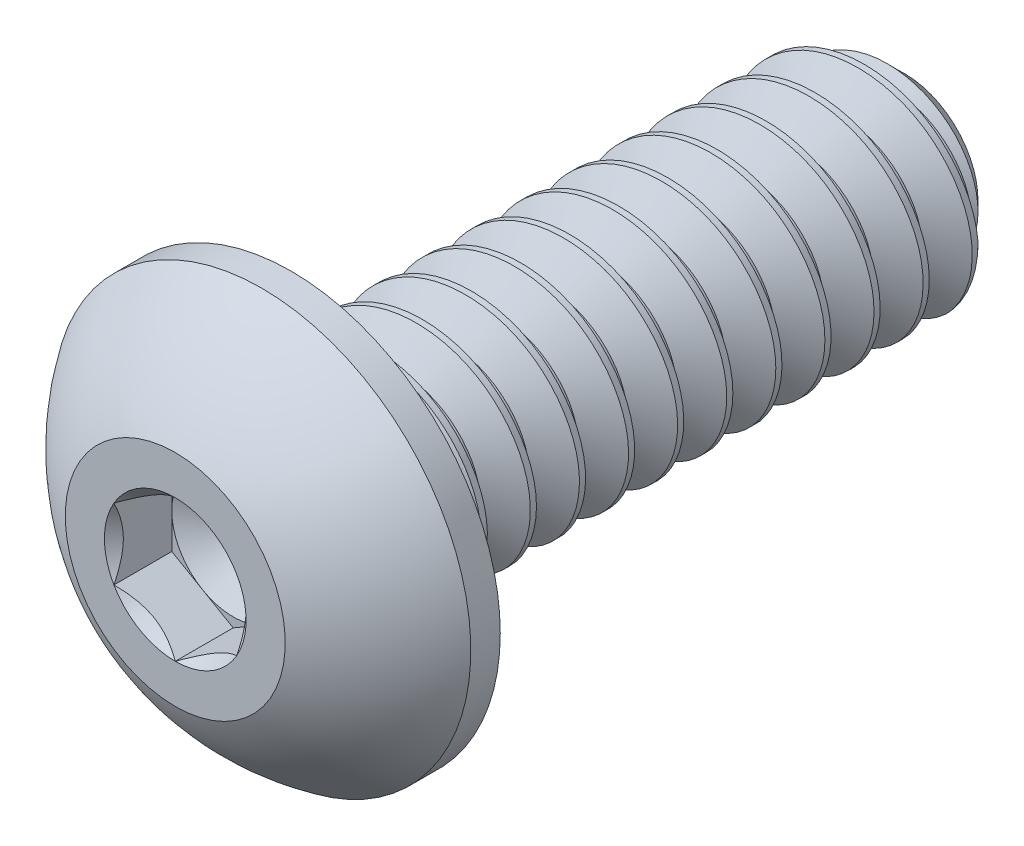
from build123d import *

# Parameters (mm, degrees)
SKETCH1_W          = 7.9375
SKETCH1_H          = 1.4224
CHAMFER1_SIZE      = 0.47625
CUT_SWEEP1_PITCH   = 0.635
SKETCH4_R          = 2.7051
EXTRUDE1_DEPTH     = 1.4986
CUT_EXTRUDE1_DEPTH = 0.7493
SKETCH7_R          = 0.916543552
CUT_EXTRUDE4_DEPTH = 0.7493
CUT_EXTRUDE4_DRAFT = -45
SKETCH8_R          = 0.79375
CUT_EXTRUDE5_DEPTH = 0.249766667
CUT_EXTRUDE5_DRAFT = -60


with BuildPart() as part:
    # Sketch1 → Revolve1 (revolve)
    with BuildSketch(Plane(origin=(0, 0, 0), x_dir=(0, 0, -1), z_dir=(1, 0, 0))):
        with Locations((3.96875, 0.7112)):
            Rectangle(SKETCH1_W, SKETCH1_H)
    revolve(axis=Axis((0, 0, 0), (0, 0, 1)))

    # Chamfer1
    chamfer1_edges = [part.edges().sort_by_distance(p)[0] for p in [
        (0, -1.4224, -7.9375),
    ]]
    chamfer(chamfer1_edges, length=CHAMFER1_SIZE)

    # Cut-Sweep1: arcs per turn and ends read off the stored shape
    # Cut-Sweep1: the profile of Sketch10 profile screwed along a right-hand helix through 17.5 turns, 6 arcs to a turn; built about Z, then put on its axis
    cut_sweep1_z = Axis((0, 0, 0), (0, 0, 1))
    cut_sweep1_corners = [(1.4227, 0, -0.079201795), (1.4227, 0, -0.635173205), (1.009955401, 0, -0.396875), (1.009955401, 0, -0.3175)]
    with BuildLine(mode=Mode.PRIVATE) as cut_sweep1_profile:
        Line(cut_sweep1_corners[0], cut_sweep1_corners[1])
        Line(cut_sweep1_corners[1], cut_sweep1_corners[2])
        Line(cut_sweep1_corners[2], cut_sweep1_corners[3])
        Line(cut_sweep1_corners[3], cut_sweep1_corners[0])
    cut_sweep1_cap = Face(cut_sweep1_profile.wire())
    cut_sweep1_turn_angles = [0, 30, 60, 90, 120, 150, 180, 210, 240, 270, 300, 330, 360]
    cut_sweep1_turn_weights = [1, 0.8660254037844387, 1, 0.8660254037844387, 1, 0.8660254037844387, 1, 0.8660254037844387, 1, 0.8660254037844387, 1, 0.8660254037844387, 1]
    cut_sweep1_turn_rails = [Edge.make_bspline([Vector(p[0], p[1], 0).rotate(cut_sweep1_z, cut_sweep1_turn_angles[k]) / cut_sweep1_turn_weights[k] + Vector(0, 0, p[2] + CUT_SWEEP1_PITCH * cut_sweep1_turn_angles[k] / 360) for k in range(13)], [0, 0, 0, 1, 1, 2, 2, 3, 3, 4, 4, 5, 5, 6, 6, 6], 2, cut_sweep1_turn_weights) for p in cut_sweep1_corners]
    cut_sweep1_turn_sides = [Face.make_surface_from_curves(cut_sweep1_turn_rails[p[0]], cut_sweep1_turn_rails[p[1]]) for p in [(0, 1), (1, 2), (2, 3), (3, 0)]]
    cut_sweep1_last_angles = [6120, 6150, 6180, 6210, 6240, 6270, 6300]
    cut_sweep1_last_weights = [1, 0.8660254037844387, 1, 0.8660254037844387, 1, 0.8660254037845101, 1]
    cut_sweep1_last_rails = [Edge.make_bspline([Vector(p[0], p[1], 0).rotate(cut_sweep1_z, cut_sweep1_last_angles[k]) / cut_sweep1_last_weights[k] + Vector(0, 0, p[2] + CUT_SWEEP1_PITCH * cut_sweep1_last_angles[k] / 360) for k in range(7)], [0, 0, 0, 1, 1, 2, 2, 3, 3, 3], 2, cut_sweep1_last_weights) for p in cut_sweep1_corners]
    cut_sweep1_last_sides = [Face.make_surface_from_curves(cut_sweep1_last_rails[p[0]], cut_sweep1_last_rails[p[1]]) for p in [(0, 1), (1, 2), (2, 3), (3, 0)]]
    cut_sweep1 = Plane(origin=(0, 0, -7.9375), x_dir=(0.7071067811865488, 0.7071067811865462, 0), z_dir=(0, 0, 1)) * Solid(Shell([*[p.moved(Location((0, 0, CUT_SWEEP1_PITCH * i))) for i in range(17) for p in cut_sweep1_turn_sides], *cut_sweep1_last_sides, cut_sweep1_cap, cut_sweep1_cap.rotate(cut_sweep1_z, 6300).moved(Location((0, 0, CUT_SWEEP1_PITCH * 6300 / 360)))]))
    add(cut_sweep1, mode=Mode.SUBTRACT)

    # Sketch4 → Extrude1 (add)
    with BuildSketch(Plane.XY):
        Circle(SKETCH4_R)
    extrude(amount=EXTRUDE1_DEPTH)

    # Sketch9 → Cut-Revolve3 (revolve, cut)
    with BuildSketch(Plane(origin=(0, 0, 0), x_dir=(0, 0, -1), z_dir=(1, 0, 0)), mode=Mode.PRIVATE) as cut_revolve3_sk:
        with BuildLine():
            Line((0, 2.7051), (-0.381, 2.7051))
            ThreePointArc((-0.381, 2.7051), (-1.025093234, 2.138064897), (-1.4986, 1.4224))
            Line((-1.4986, 1.4224), (-1.8796, 1.4224))
            Line((-1.8796, 1.4224), (-1.8796, 3.0861))
            Line((-1.8796, 3.0861), (0, 3.0861))
            Line((0, 3.0861), (0, 2.7051))
        make_face()
    revolve(cut_revolve3_sk.sketch.rotate(Axis((0, 0, 0), (0, 0, 1)), 170.905365291), axis=Axis((0, 0, 0), (0, 0, 1)), mode=Mode.SUBTRACT)

    # Sketch6 → Cut-Extrude1 (cut)
    with BuildSketch(Plane.XY.offset(1.4986)):
        Polygon((0, -0.916543552), (0.79375, -0.458271776), (0.79375, 0.458271776), (0, 0.916543552), (-0.79375, 0.458271776), (-0.79375, -0.458271776), align=None)
    extrude(amount=-CUT_EXTRUDE1_DEPTH, mode=Mode.SUBTRACT)


with BuildPart() as cut_extrude4_tool:
    # Sketch7 → Cut-Extrude4 (with draft: the straight prism first)
    with BuildSketch(Plane.XY.offset(1.4986)):
        Circle(SKETCH7_R)
    extrude(amount=-CUT_EXTRUDE4_DEPTH)
    # Cut-Extrude4: the draft: its side faces are tilted about the plane it starts from
    cut_extrude4_sides = [cut_extrude4_tool.faces().sort_by_distance(p)[0] for p in [
        (-0.916543552, 0, 1.12395),
    ]]
    draft(cut_extrude4_sides, Plane.XY.offset(1.4986), CUT_EXTRUDE4_DRAFT)


with BuildPart() as part_1:
    add(part.part)

    # Cut-Extrude4: cut by cut_extrude4_tool
    add(cut_extrude4_tool.part, mode=Mode.SUBTRACT)


with BuildPart() as cut_extrude5_tool:
    # Sketch8 → Cut-Extrude5 (with draft: the straight prism first)
    with BuildSketch(Plane.XY.offset(0.7493)):
        Circle(SKETCH8_R)
    extrude(amount=-CUT_EXTRUDE5_DEPTH)
    # Cut-Extrude5: the draft: its side faces are tilted about the plane it starts from
    cut_extrude5_sides = [cut_extrude5_tool.faces().sort_by_distance(p)[0] for p in [
        (-0.79375, 0, 0.624416667),
    ]]
    draft(cut_extrude5_sides, Plane.XY.offset(0.7493), CUT_EXTRUDE5_DRAFT)


with BuildPart() as part_2:
    add(part_1.part)

    # Cut-Extrude5: cut by cut_extrude5_tool
    add(cut_extrude5_tool.part, mode=Mode.SUBTRACT)


solid = part_2.part
